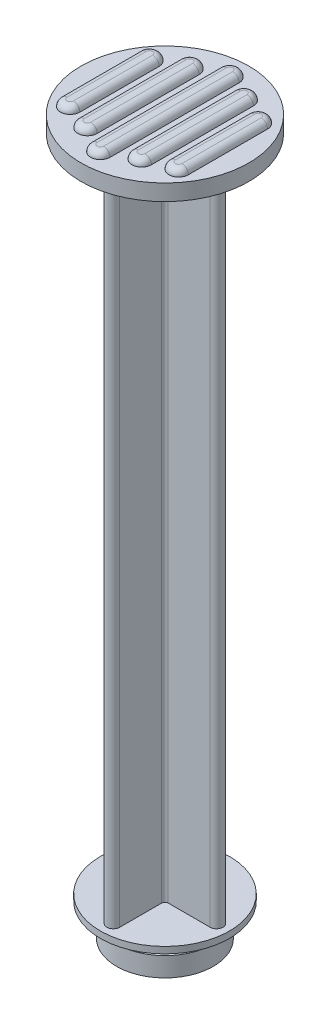
from build123d import *

# Parameters (mm, degrees)
BOSS_EXTRUDE1_DEPTH = 102
SKETCH5_R           = 13
BOSS_EXTRUDE2_DEPTH = 2.5
BOSS_EXTRUDE3_DEPTH = 1
FILLET1_R           = 1


with BuildPart() as part:
    # Sketch1 → Revolve1 (revolve)
    with BuildSketch(Plane.XY, mode=Mode.PRIVATE) as revolve1_sk:
        Polygon((0, 0), (7.5, 0), (7.5, 3), (6, 3), (6, 5), (10, 5), (10, 6), (0, 6), align=None)
    revolve(revolve1_sk.sketch.rotate(Axis((0, 6, 0), (0, -1, 0)), 180), axis=Axis((0, 6, 0), (0, -1, 0)))

    # Sketch4 → Boss-Extrude1 (add)
    with BuildSketch(Plane(origin=(0, 6, 0), x_dir=(1, 0, 0), z_dir=(0, 1, 0))):
        with BuildLine():
            Line((-1, 8), (-1, 1.5))
            ThreePointArc((-1, 1.5), (-1.146446609, 1.146446609), (-1.5, 1))
            Line((-1.5, 1), (-8, 1))
            ThreePointArc((-8, 1), (-9, 0), (-8, -1))
            Line((-8, -1), (-1.5, -1))
            ThreePointArc((-1.5, -1), (-1.146446609, -1.146446609), (-1, -1.5))
            Line((-1, -1.5), (-1, -8))
            ThreePointArc((-1, -8), (0, -9), (1, -8))
            Line((1, -8), (1, -1.5))
            ThreePointArc((1, -1.5), (1.146446609, -1.146446609), (1.5, -1))
            Line((1.5, -1), (8, -1))
            ThreePointArc((8, -1), (9, 0), (8, 1))
            Line((8, 1), (1.5, 1))
            ThreePointArc((1.5, 1), (1.146446609, 1.146446609), (1, 1.5))
            Line((1, 1.5), (1, 8))
            ThreePointArc((1, 8), (0, 9), (-1, 8))
        make_face()
    extrude(amount=BOSS_EXTRUDE1_DEPTH)

    # Sketch5 → Boss-Extrude2 (add)
    with BuildSketch(Plane(origin=(0, 108, 0), x_dir=(1, 0, 0), z_dir=(0, 1, 0))):
        with Locations(Location((0, 0, 0), (0, 0, 180))):
            Circle(SKETCH5_R)
    extrude(amount=BOSS_EXTRUDE2_DEPTH)

    # Sketch6 → Boss-Extrude3 (add)
    with BuildSketch(Plane(origin=(0, 110.5, 0), x_dir=(1, 0, 0), z_dir=(0, 1, 0))):
        with BuildLine():
            Line((-1.5, 10), (-1.5, -10))
            ThreePointArc((-1.5, -10), (0, -11.5), (1.5, -10))
            Line((1.5, -10), (1.5, 10))
            ThreePointArc((1.5, 10), (0, 11.5), (-1.5, 10))
        make_face()
        with BuildLine():
            Line((-5.7, 8), (-5.7, -7.799265344))
            ThreePointArc((-5.7, -7.799265344), (-4.2, -9.299265344), (-2.7, -7.799265344))
            Line((-2.7, -7.799265344), (-2.7, 8))
            ThreePointArc((-2.7, 8), (-4.2, 9.5), (-5.7, 8))
        make_face()
        with BuildLine():
            Line((-9.9, 6), (-9.9, -6.275084591))
            ThreePointArc((-9.9, -6.275084591), (-8.4, -7.775084591), (-6.9, -6.275084591))
            Line((-6.9, -6.275084591), (-6.9, 6))
            ThreePointArc((-6.9, 6), (-8.4, 7.5), (-9.9, 6))
        make_face()
        with BuildLine():
            Line((9.9, 6), (9.9, -6.275084591))
            ThreePointArc((9.9, -6.275084591), (8.4, -7.775084591), (6.9, -6.275084591))
            Line((6.9, -6.275084591), (6.9, 6))
            ThreePointArc((6.9, 6), (8.4, 7.5), (9.9, 6))
        make_face()
        with BuildLine():
            Line((5.7, 8), (5.7, -7.799265344))
            ThreePointArc((5.7, -7.799265344), (4.2, -9.299265344), (2.7, -7.799265344))
            Line((2.7, -7.799265344), (2.7, 8))
            ThreePointArc((2.7, 8), (4.2, 9.5), (5.7, 8))
        make_face()
    extrude(amount=BOSS_EXTRUDE3_DEPTH)

    # Fillet1
    fillet1_edges = [part.edges().sort_by_distance(p)[0] for p in [
        (9.9, 111.5, 0.137542295),
        (8.4, 111.5, 7.775084591),
        (6.9, 111.5, 0.137542295),
        (8.4, 111.5, -7.5),
        (5.7, 111.5, -0.100367328),
        (4.2, 111.5, 9.299265344),
        (2.7, 111.5, -0.100367328),
        (4.2, 111.5, -9.5),
        (1.5, 111.5, 0),
        (0, 111.5, 11.5),
        (-1.5, 111.5, 0),
        (0, 111.5, -11.5),
        (-2.7, 111.5, -0.100367328),
        (-4.2, 111.5, 9.299265344),
        (-5.7, 111.5, -0.100367328),
        (-4.2, 111.5, -9.5),
        (-6.9, 111.5, 0.137542295),
        (-8.4, 111.5, 7.775084591),
        (-9.9, 111.5, 0.137542295),
        (-8.4, 111.5, -7.5),
    ]]
    fillet(fillet1_edges, radius=FILLET1_R - 0.0001)  # a hair under: the kernel refuses the full size


solid = part.part
